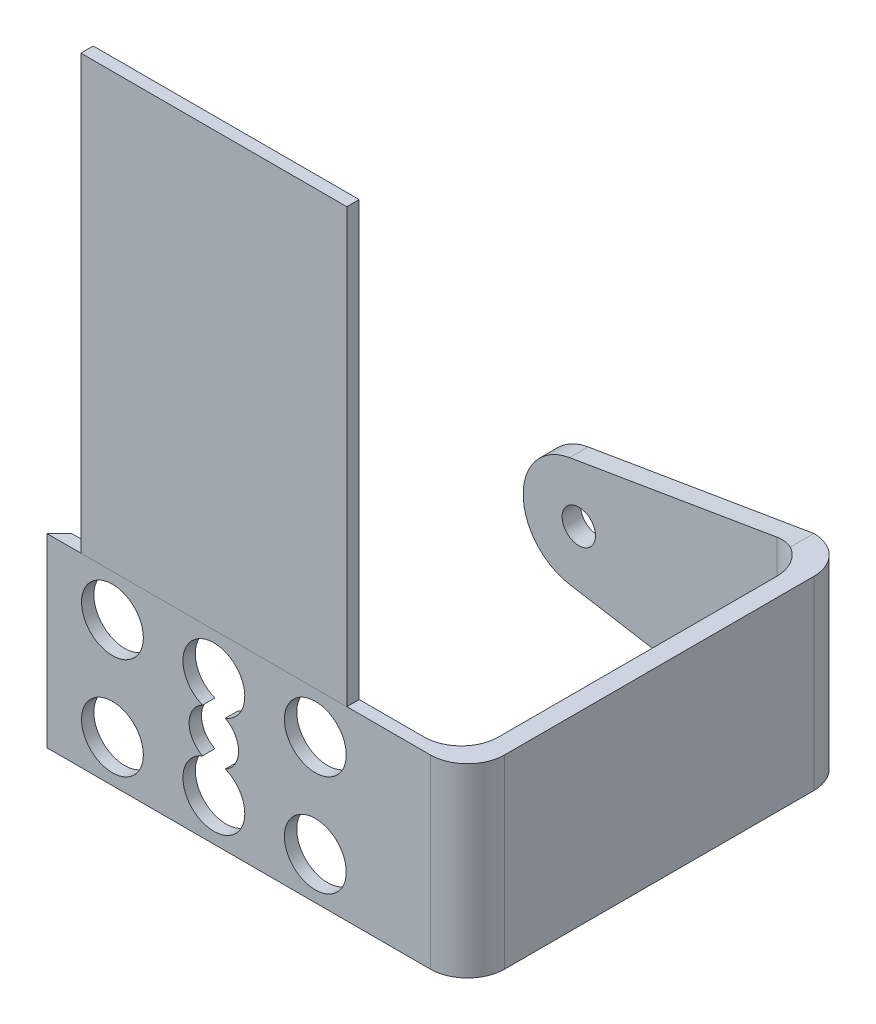
from build123d import *

# Parameters (mm, degrees)
SKETCH_1_W          = 27
SKETCH_1_H          = 15
EXTRUDE_1_DEPTH     = 1
SKETCH_2_R          = 2.5
CUT_EXTRUDE_1_DEPTH = 16.475787541
EXTRUDE_2_DEPTH     = 15
SKETCH_6_W          = 1.5
SKETCH_6_H          = 2
EXTRUDE_3_DEPTH     = 2
CHAMFER_1_SIZE      = 1
CUT_EXTRUDE_4_REACH = 39.101
SKETCH_8_R          = 2
SKETCH_9_W          = 21.5
SKETCH_9_H          = 35
EXTRUDE_4_DEPTH     = 1
SKETCH_7_R          = 1.35
CUT_EXTRUDE_5_DEPTH = 10
FILLET_1_R          = 3
CUT_EXTRUDE_START   = -1.901924
CUT_EXTRUDE_6_DEPTH = 1.901924


with BuildPart() as part:
    # 草图1 → 凸台-拉伸1 (new body)
    with BuildSketch(Plane.XY):
        Rectangle(SKETCH_1_W, SKETCH_1_H)
    extrude(amount=EXTRUDE_1_DEPTH)

    # 草图2 → 切除-拉伸1 (cut, through all)
    with BuildSketch(Plane.XY.offset(1)):
        with Locations((0, 4.1)):
            Circle(SKETCH_2_R)
        with Locations((0, -4.1)):
            Circle(SKETCH_2_R)
        with Locations((8.2, 4.1)):
            Circle(SKETCH_2_R)
        with Locations((8.2, -4.1)):
            Circle(SKETCH_2_R)
        with Locations((-8.2, 4.1)):
            Circle(SKETCH_2_R)
        with Locations((-8.2, -4.1)):
            Circle(SKETCH_2_R)
    extrude(amount=-CUT_EXTRUDE_1_DEPTH, mode=Mode.SUBTRACT)

    # 草图3 → 凸台-拉伸2 (add)
    with BuildSketch(Plane.XZ.offset(7.5)):
        Polygon((13.5, 0), (19, 0), (19, -28.5), (-4.5, -28.5), (-4.5, -30), (20.5, -30), (20.5, 1), (13.5, 1), align=None)
    extrude(amount=-EXTRUDE_2_DEPTH)

    # 草图6 → 凸台-拉伸3 (add, symmetric)
    with BuildSketch(Plane(origin=(0, 0, 0), x_dir=(1, 0, 0), z_dir=(0, 1, 0))):
        Polygon((19, 0), (19, 5), (14, 0), align=None)
        Polygon((19, 28.5), (14, 28.5), (19, 23.5), align=None)
        with Locations((18.25, 20)):
            Rectangle(SKETCH_6_W, SKETCH_6_H)
    extrude(amount=EXTRUDE_3_DEPTH, both=True)

    # 倒角1
    chamfer_1_edges = [part.edges().sort_by_distance(p)[0] for p in [
        (-13.5, 0, 0),
    ]]
    chamfer(chamfer_1_edges, length=CHAMFER_1_SIZE - 0.0001)  # a hair under: the kernel refuses the full size

    # 草图8 → 切除-拉伸4 (cut, up to next)
    with BuildSketch(Plane(origin=(0, 0, 0), x_dir=(-1, 0, 0), z_dir=(0, 0, -1)), mode=Mode.PRIVATE) as cut_extrude_4_sk1:
        Circle(SKETCH_8_R)
    cut_extrude_4_tool1 = extrude(cut_extrude_4_sk1.sketch, amount=-CUT_EXTRUDE_4_REACH, mode=Mode.PRIVATE) & part.part
    add(cut_extrude_4_tool1.solids().sort_by_distance((0, 0, 0))[0], mode=Mode.SUBTRACT)

    # 草图7 → 切除-拉伸5 (cut)
    with BuildSketch(Plane(origin=(0, 0, -30), x_dir=(-1, 0, 0), z_dir=(0, 0, -1))):
        Circle(SKETCH_7_R)
    extrude(amount=-CUT_EXTRUDE_5_DEPTH, mode=Mode.SUBTRACT)

    # 圆角1
    fillet_1_edges = [part.edges().sort_by_distance(p)[0] for p in [
        (20.5, 0, 1),
        (20.5, 0, -30),
        (19, 4.75, -28.5),
        (19, 4.75, 0),
        (19, -4.75, 0),
        (19, -4.75, -28.5),
    ]]
    fillet(fillet_1_edges, radius=FILLET_1_R)

    # 草图10 → 切除-拉伸6 (cut)
    with BuildSketch(Plane(origin=(0, 0, -30), x_dir=(-1, 0, 0), z_dir=(0, 0, -1)).offset(CUT_EXTRUDE_START)):
        with BuildLine():
            Line((-17.5, 7.5), (0.744827586, 4.437931034))
            ThreePointArc((0.744827586, 4.437931034), (3.435238284, 2.906740087), (4.5, 0))
            Line((4.5, 0), (4.5, 7.5))
            Line((4.5, 7.5), (-17.5, 7.5))
        make_face()
        with BuildLine():
            Line((4.5, -7.5), (4.5, 0))
            ThreePointArc((4.5, 0), (3.435238284, -2.906740087), (0.744827586, -4.437931034))
            Line((0.744827586, -4.437931034), (-17.5, -7.5))
            Line((-17.5, -7.5), (4.5, -7.5))
        make_face()
    extrude(amount=CUT_EXTRUDE_6_DEPTH, mode=Mode.SUBTRACT)


with BuildPart() as body_2:
    # 草图9 → 凸台-拉伸4 (new body)
    with BuildSketch(Plane.XY.offset(1)):
        with Locations((0, 25)):
            Rectangle(SKETCH_9_W, SKETCH_9_H)
    extrude(amount=-EXTRUDE_4_DEPTH)


solid = Compound([part.part, body_2.part])
